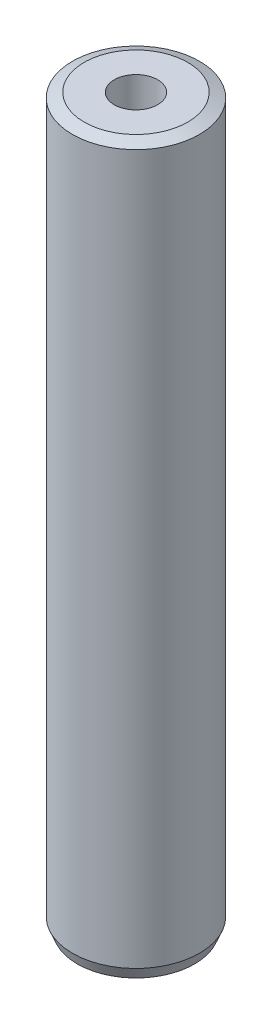
from build123d import *
from OCP.BRepFilletAPI import BRepFilletAPI_MakeChamfer

# Parameters (mm, degrees)
SKETCH1_R           = 52.5
BOSS_EXTRUDE1_DEPTH = 600
SKETCH2_R           = 17.935820862
CUT_EXTRUDE1_DEPTH  = 605.576297914
CHAMFER1_SIZE       = 4.008312008
CHAMFER1_SIZE2      = 9.688612163


with BuildPart() as part:
    # Sketch1 → Boss-Extrude1 (new body)
    with BuildSketch(Plane(origin=(0, 0, 0), x_dir=(1, 0, 0), z_dir=(0, 1, 0))):
        Circle(SKETCH1_R)
    extrude(amount=BOSS_EXTRUDE1_DEPTH)

    # Sketch2 → Cut-Extrude1 (cut, through all)
    with BuildSketch(Plane(origin=(0, 0, 0), x_dir=(1, 0, 0), z_dir=(0, 1, 0))):
        Circle(SKETCH2_R)
    extrude(amount=CUT_EXTRUDE1_DEPTH, mode=Mode.SUBTRACT)

    # Chamfer1: one chamfer whose edges measure the first distance from different faces: ONE call of the kernel's chamfer builder (chamfer() names one face for all edges)
    chamfer1_edges_1 = [part.edges().sort_by_distance(p)[0] for p in [
        (-52.5, 600, 0),
    ]]
    chamfer1_side_1 = [part.faces().sort_by_distance(p)[0] for p in [
        (-52.5, 300, 0),
    ]]
    chamfer1_edges_2 = [part.edges().sort_by_distance(p)[0] for p in [
        (-52.5, 0, 0),
    ]]
    chamfer1_side_2 = [part.faces().sort_by_distance(p)[0] for p in [
        (-51.01507576, 0, 0),
    ]]
    chamfer1 = BRepFilletAPI_MakeChamfer(part.part.solid().wrapped)
    for e in chamfer1_edges_1:
        chamfer1.Add(CHAMFER1_SIZE, CHAMFER1_SIZE2, e.wrapped, chamfer1_side_1[0].wrapped)  # the first distance lies on this face
    for e in chamfer1_edges_2:
        chamfer1.Add(CHAMFER1_SIZE, CHAMFER1_SIZE2, e.wrapped, chamfer1_side_2[0].wrapped)  # the first distance lies on this face
    add(Compound.cast(chamfer1.Shape()), mode=Mode.REPLACE)


solid = part.part
